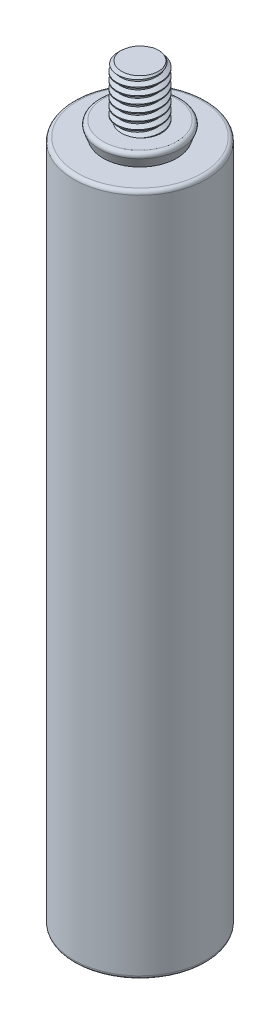
from build123d import *

# Parameters (mm, degrees)
CHAMFER1_SIZE = 0.5
THREAD1_PITCH = 1
THREAD1_TO    = 7.5
FILLET1_R     = 0.5


with BuildPart() as part:
    # Sketch1 one side → Revolve1 (revolve)
    with BuildSketch(Plane.XY, mode=Mode.PRIVATE) as revolve1_sk:
        Polygon((3, 87.875), (0, 87.875), (0, 55.375), (3, 55.375), (3, -12.625), (5.5, -12.625), (5.5, -14.125), (9, -14.125), (9, 78.875), (5, 78.875), (5.74735815, 80.875), (3, 80.875), align=None)
    revolve(revolve1_sk.sketch.rotate(Axis((0, 111.539954176, 0), (0, -1, 0)), 90), axis=Axis((0, 111.539954176, 0), (0, -1, 0)))

    # Chamfer1
    chamfer1_edges = [part.edges().sort_by_distance(p)[0] for p in [
        (0, 87.875, -3),
    ]]
    chamfer(chamfer1_edges, length=CHAMFER1_SIZE)

    # Thread1: arcs per turn and ends read off the stored shape
    # Thread1: the profile of Thread Profile1 profile screwed along a right-hand helix through 8 turns, 8 arcs to a turn; built about Z, then put on its axis
    thread1_z = Axis((0, 0, 0), (0, 0, 1))
    thread1_corners = [(3.0003, 0, -0.000173205), (3.0003, 0, 0.875173202), (2.458734125, 0, 0.562499999), (2.458734125, 0, 0.312499999)]
    with BuildLine(mode=Mode.PRIVATE) as thread1_profile:
        Line(thread1_corners[0], thread1_corners[1])
        Line(thread1_corners[1], thread1_corners[2])
        Line(thread1_corners[2], thread1_corners[3])
        Line(thread1_corners[3], thread1_corners[0])
    thread1_cap = Face(thread1_profile.wire())
    thread1_turn_angles = [0, 22.5, 45, 67.5, 90, 112.5, 135, 157.5, 180, 202.5, 225, 247.5, 270, 292.5, 315, 337.5, 360]
    thread1_turn_weights = [1, 0.9238795325112867, 1, 0.9238795325112867, 1, 0.9238795325112867, 1, 0.9238795325112867, 1, 0.9238795325112867, 1, 0.9238795325112867, 1, 0.9238795325112867, 1, 0.9238795325112867, 1]
    thread1_turn_rails = [Edge.make_bspline([Vector(p[0], p[1], 0).rotate(thread1_z, thread1_turn_angles[k]) / thread1_turn_weights[k] + Vector(0, 0, p[2] + THREAD1_PITCH * thread1_turn_angles[k] / 360) for k in range(17)], [0, 0, 0, 1, 1, 2, 2, 3, 3, 4, 4, 5, 5, 6, 6, 7, 7, 8, 8, 8], 2, thread1_turn_weights) for p in thread1_corners]
    thread1_turn_sides = [Face.make_surface_from_curves(thread1_turn_rails[p[0]], thread1_turn_rails[p[1]]) for p in [(0, 1), (1, 2), (2, 3), (3, 0)]]
    thread1 = Plane(origin=(0, 88.375, 0), x_dir=(-1, 0, 0), z_dir=(0, -1, 0)) * split(Solid(Shell([*[p.moved(Location((0, 0, THREAD1_PITCH * i))) for i in range(8) for p in thread1_turn_sides], thread1_cap, thread1_cap.rotate(thread1_z, 2880).moved(Location((0, 0, THREAD1_PITCH * 2880 / 360)))])), bisect_by=Plane.XY.offset(THREAD1_TO), keep=Keep.BOTTOM, mode=Mode.PRIVATE)
    add(thread1, mode=Mode.SUBTRACT)

    # Fillet1
    fillet1_edges = [part.edges().sort_by_distance(p)[0] for p in [
        (0, 80.875, -5.74735815),
        (0, 78.875, -9),
        (0, -14.125, -9),
        (0, -14.125, -5.5),
    ]]
    fillet(fillet1_edges, radius=FILLET1_R)


solid = part.part
